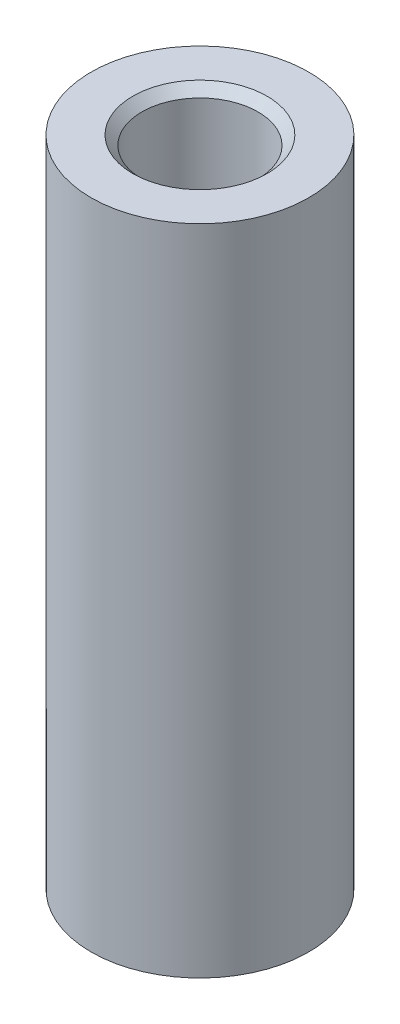
from build123d import *

# Parameters (mm, degrees)
SKETCH1_R            = 3
BOSS_EXTRUDE1_DEPTH  = 18
M3_CLEARANCE_HOLE1_D = 3.2
CHAMFER1_SIZE        = 0.25


with BuildPart() as part:
    # Sketch1 → Boss-Extrude1 (new body)
    with BuildSketch(Plane(origin=(0, 0, 0), x_dir=(1, 0, 0), z_dir=(0, 1, 0))):
        Circle(SKETCH1_R)
    extrude(amount=BOSS_EXTRUDE1_DEPTH)

    # M3 Clearance Hole1 (through all)
    with Locations(Plane(origin=(0, 18, 0), x_dir=(1, 0, 0), z_dir=(0, 1, 0))):
        with Locations((0, 0)):
            Hole(M3_CLEARANCE_HOLE1_D / 2)

    # Chamfer1
    chamfer1_edges = [part.edges().sort_by_distance(p)[0] for p in [
        (1.6, 18, 0),
        (1.6, 0, 0),
    ]]
    chamfer(chamfer1_edges, length=CHAMFER1_SIZE)


solid = part.part
